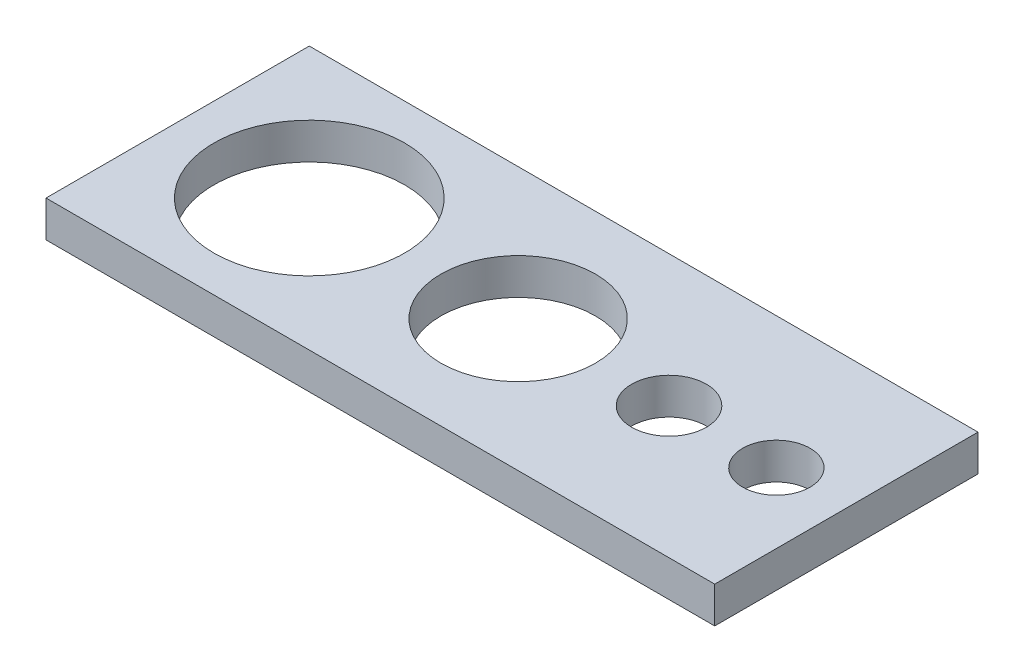
from build123d import *

# Parameters (mm, degrees)
SKETCH_1_R      = 13.15
SKETCH_1_R_2    = 10.65
SKETCH_1_R_3    = 5.15
SKETCH_1_R_4    = 4.65
EXTRUDE_1_DEPTH = 5


with BuildPart() as part:
    # Эскиз1 → Бобышка-Вытянуть1 (new body)
    with BuildSketch(Plane(origin=(0, 0, 0), x_dir=(1, 0, 0), z_dir=(0, 1, 0))):
        Polygon((0, 0), (0, 18.15), (92.2, 18.15), (92.2, -18.15), (0, -18.15), align=None)
        with Locations((18.15, 0)):
            Circle(SKETCH_1_R, mode=Mode.SUBTRACT)
        with Locations((46.95, 0)):
            Circle(SKETCH_1_R_2, mode=Mode.SUBTRACT)
        with Locations((67.75, 0)):
            Circle(SKETCH_1_R_3, mode=Mode.SUBTRACT)
        with Locations((82.55, 0)):
            Circle(SKETCH_1_R_4, mode=Mode.SUBTRACT)
    extrude(amount=EXTRUDE_1_DEPTH)


solid = part.part
